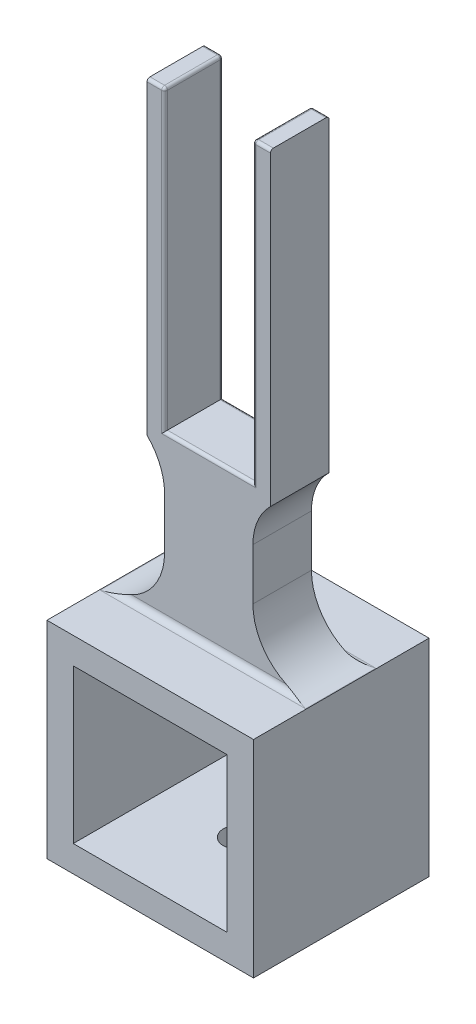
from build123d import *

# Parameters (mm, degrees)
SKETCH2_W               = 25.3
SKETCH2_H               = 25.3
BOSS_EXTRUDE1_DEPTH     = 15
CUT_EXTRUDE1_DEPTH      = 94.422320673
CUT_EXTRUDE1_DEPTH_BACK = 94.422320673
SKETCH3_W               = 10
SKETCH3_H               = 61.95
FILLET1_R               = 10
FILLET2_R               = 1
SKETCH4_R               = 7.5
BOSS_EXTRUDE2_DEPTH     = 5
FILLET3_R               = 1
CUT_EXTRUDE2_REACH      = 101.97
SKETCH5_R               = 2.5
BOSS_EXTRUDE3_DEPTH     = 10
FILLET4_R               = 10
SKETCH11_W              = 15.1
SKETCH11_H              = 10
CUT_EXTRUDE4_DEPTH      = 34.025
FILLET5_R               = 0.5
FILLET6_R               = 0.5
CUT_EXTRUDE5_DEPTH      = 100.956052843
CUT_EXTRUDE5_DEPTH_BACK = 100.956052843
SKETCH12_W              = 26.3
SKETCH12_H              = 26.3


with BuildPart() as part:
    # Sketch2 → Boss-Extrude1 (new, symmetric)
    with BuildSketch(Plane.XY):
        Polygon((-7.55, -53.4), (-7.55, 8.55), (7.55, 8.55), (7.55, -53.4), (17.65, -53.4), (17.65, -88.7), (-17.65, -88.7), (-17.65, -53.4), align=None)
        with Locations((0, -71.05)):
            Rectangle(SKETCH2_W, SKETCH2_H, mode=Mode.SUBTRACT)
    extrude(amount=BOSS_EXTRUDE1_DEPTH, both=True)

    # Sketch3 → Cut-Extrude1 (cut, two sides: drawn at the far end of the back side and taken through both)
    with BuildSketch(Plane(origin=(7.55, 0, 0), x_dir=(0, 0, -1), z_dir=(1, 0, 0)).offset(-CUT_EXTRUDE1_DEPTH_BACK)):
        with Locations((-10, -22.425)):
            Rectangle(SKETCH3_W, SKETCH3_H)
        with Locations((10, -22.425)):
            Rectangle(SKETCH3_W, SKETCH3_H)
    extrude(amount=CUT_EXTRUDE1_DEPTH + CUT_EXTRUDE1_DEPTH_BACK, mode=Mode.SUBTRACT)

    # Fillet1
    fillet1_edges = [part.edges().sort_by_distance(p)[0] for p in [
        (-7.55, -53.4, 0),
        (7.55, -53.4, 0),
    ]]
    fillet(fillet1_edges, radius=FILLET1_R)

    # Fillet2
    fillet2_edges = [part.edges().sort_by_distance(p)[0] for p in [
        (0, -53.4, 5),
        (0, -53.4, -5),
    ]]
    fillet(fillet2_edges, radius=FILLET2_R)

    # Sketch4 → Boss-Extrude2 (add)
    with BuildSketch(Plane.XZ.offset(88.7)):
        Circle(SKETCH4_R)
        Polygon((5.369357503, 0), (2.684678752, 4.65), (-2.684678752, 4.65), (-5.369357503, 0), (-2.684678752, -4.65), (2.684678752, -4.65), align=None, mode=Mode.SUBTRACT)
    extrude(amount=BOSS_EXTRUDE2_DEPTH)

    # Fillet3
    fillet3_edges = [part.edges().sort_by_distance(p)[0] for p in [
        (-7.5, -88.7, 0),
    ]]
    fillet(fillet3_edges, radius=FILLET3_R)

    # Sketch5 → Cut-Extrude2 (cut, up to next)
    with BuildSketch(Plane.XZ.offset(88.7), mode=Mode.PRIVATE) as cut_extrude2_sk1:
        Circle(SKETCH5_R)
    cut_extrude2_tool1 = extrude(cut_extrude2_sk1.sketch, amount=-CUT_EXTRUDE2_REACH, mode=Mode.PRIVATE) & part.part
    add(cut_extrude2_tool1.solids().sort_by_distance((0, -88.7, 0))[0], mode=Mode.SUBTRACT)

    # Sketch9 → Boss-Extrude3 (add)
    with BuildSketch(Plane.XY.offset(5)):
        Polygon((-10.55, -27.475), (-7.55, -27.475), (-7.55, -25.475), (-7.55, 8.55), (-7.55, 25.325), (-10.55, 25.325), (-10.55, -25.325), align=None)
        Polygon((10.55, 25.325), (7.55, 25.325), (7.55, 8.55), (7.55, -25.475), (7.55, -27.475), (10.55, -27.475), (10.55, -25.325), align=None)
        Polygon((7.55, -27.475), (7.55, -25.475), (7.4, -25.475), (-7.4, -25.475), (-7.55, -25.475), (-7.55, -27.475), align=None)
    extrude(amount=-BOSS_EXTRUDE3_DEPTH)

    # Fillet4
    # the kernel refuses this fillet: 10 mm, written as the material it adds along each edge
    with BuildSketch(Plane(origin=(-7.55, -27.475, 5), x_dir=(0, -1, 0), z_dir=(0, 0, -1)), Plane(origin=(7.55, -27.475, -5), x_dir=(0, -1, 0), z_dir=(0, 0, 1))) as fillet4_piece_1:
        with BuildLine():
            CenterArc((7.141428429, 10), FILLET4_R, 224.427004001, 45.572995999)
            Line((0, 3), (-0.142828569, 2.86))
            ThreePointArc((-0.142828569, 2.86), (-0.2, 1.5), (-0.2, 0))
            Line((-0.2, 0), (0, -0.2))
            Line((0, -0.2), (7.141428429, -0.2))
            Line((7.141428429, -0.2), (7.141428429, 0))
        make_face()
    extrude(amount=10)

    # Sketch11 → Cut-Extrude4 (cut)
    with BuildSketch(Plane(origin=(0, 8.55, 0), x_dir=(1, 0, 0), z_dir=(0, 1, 0))):
        Rectangle(SKETCH11_W, SKETCH11_H)
    extrude(amount=-CUT_EXTRUDE4_DEPTH, mode=Mode.SUBTRACT)

    # Fillet5
    fillet5_edges = [part.edges().sort_by_distance(p)[0] for p in [
        (7.55, -0.075, 5),
        (7.55, -0.075, -5),
        (-7.55, -0.075, 5),
        (-7.55, -0.075, -5),
        (0, -25.475, -5),
        (0, -25.475, 5),
    ]]
    fillet(fillet5_edges, radius=FILLET5_R)

    # Fillet6
    fillet6_edges = [part.edges().sort_by_distance(p)[0] for p in [
        (9.3, 25.325, 5),
        (-9.3, 25.325, -5),
        (9.3, 25.325, -5),
        (7.55, 25.325, 0),
        (7.696446609, 25.325, 4.853553391),
        (7.696446609, 25.325, -4.853553391),
        (-7.55, 25.325, 0),
        (-9.3, 25.325, 5),
        (-7.696446609, 25.325, 4.853553391),
        (-7.696446609, 25.325, -4.853553391),
    ]]
    fillet(fillet6_edges, radius=FILLET6_R)

    # Sketch12 → Cut-Extrude5 (cut, two sides: drawn at the far end of the back side and taken through both)
    with BuildSketch(Plane.XY.offset(15).offset(-CUT_EXTRUDE5_DEPTH_BACK)):
        with Locations((0, -71.05)):
            Rectangle(SKETCH12_W, SKETCH12_H)
    extrude(amount=CUT_EXTRUDE5_DEPTH + CUT_EXTRUDE5_DEPTH_BACK, mode=Mode.SUBTRACT)


solid = part.part
